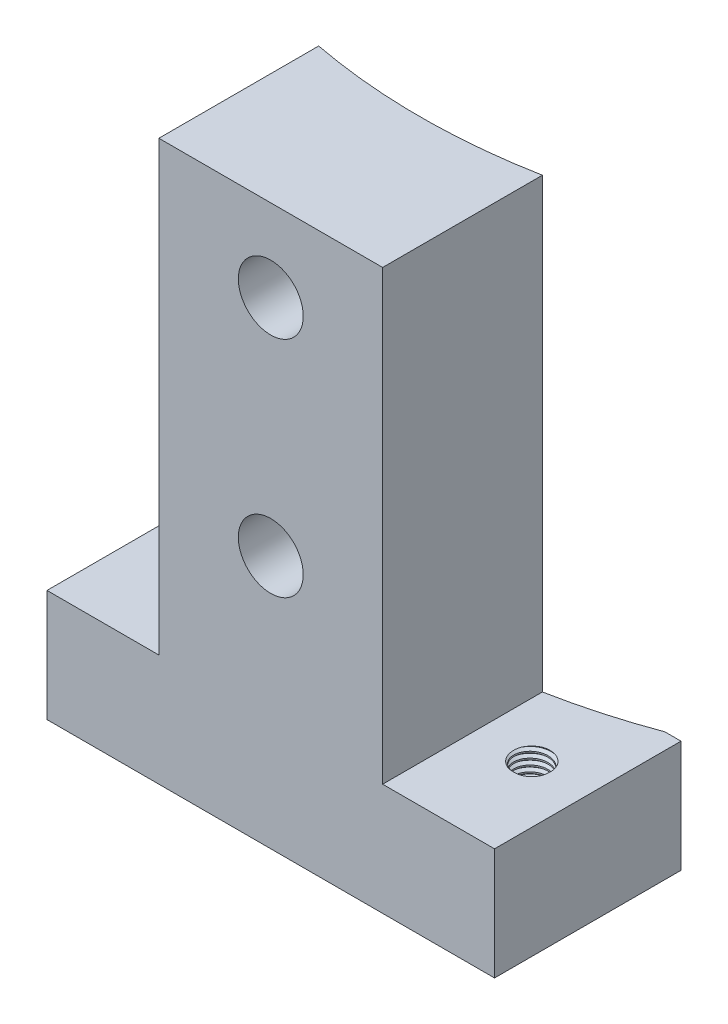
from build123d import *

# Parameters (mm, degrees)
SKIZZE1_W                       = 30
SKIZZE1_H                       = 75
AUFSATZ_LINEAR_AUSTRAGEN1_DEPTH = 25
SKIZZE2_W                       = 60
SKIZZE2_H                       = 25
AUFSATZ_LINEAR_AUSTRAGEN2_DEPTH = 15
SKIZZE3_R                       = 80
SCHNITT_LINEAR_AUSTRAGEN1_DEPTH = 80
SKIZZE4_R                       = 2.6
SCHNITT_LINEAR_AUSTRAGEN2_DEPTH = 80
SKIZZE5_R                       = 4.35
SCHNITT_LINEAR_AUSTRAGEN3_DEPTH = 13
SKIZZE6_R                       = 2.3
SCHNITT_LINEAR_AUSTRAGEN4_DEPTH = 18
GEWINDE1_PITCH                  = 0.8
GEWINDE2_PITCH                  = 0.8


with BuildPart() as part:
    # Skizze1 → Aufsatz-Linear austragen1 (new body)
    with BuildSketch(Plane.XY):
        Rectangle(SKIZZE1_W, SKIZZE1_H)
    extrude(amount=AUFSATZ_LINEAR_AUSTRAGEN1_DEPTH)

    # Skizze2 → Aufsatz-Linear austragen2 (add)
    with BuildSketch(Plane.XZ.offset(37.5)):
        with Locations((0, 12.5)):
            Rectangle(SKIZZE2_W, SKIZZE2_H)
    extrude(amount=-AUFSATZ_LINEAR_AUSTRAGEN2_DEPTH)

    # Skizze3 → Schnitt-Linear austragen1 (cut)
    with BuildSketch(Plane(origin=(0, 37.5, 0), x_dir=(1, 0, 0), z_dir=(0, 1, 0))):
        with Locations((0, 75)):
            Circle(SKIZZE3_R)
    extrude(amount=-SCHNITT_LINEAR_AUSTRAGEN1_DEPTH, mode=Mode.SUBTRACT)

    # Skizze4 → Schnitt-Linear austragen2 (cut)
    with BuildSketch(Plane.XY.offset(25)):
        with Locations((0, -3.5)):
            Circle(SKIZZE4_R)
        with Locations((0, 26.5)):
            Circle(SKIZZE4_R)
    extrude(amount=-SCHNITT_LINEAR_AUSTRAGEN2_DEPTH, mode=Mode.SUBTRACT)

    # Skizze5 → Schnitt-Linear austragen3 (cut)
    with BuildSketch(Plane.XY.offset(25)):
        with Locations((0, -3.5)):
            Circle(SKIZZE5_R)
        with Locations((0, 26.5)):
            Circle(SKIZZE5_R)
    extrude(amount=-SCHNITT_LINEAR_AUSTRAGEN3_DEPTH, mode=Mode.SUBTRACT)

    # Skizze6 → Schnitt-Linear austragen4 (cut)
    with BuildSketch(Plane(origin=(0, -22.5, 0), x_dir=(1, 0, 0), z_dir=(0, 1, 0))):
        with Locations(Location((-22.5, -12.5, 0), (0, 0, 270))):
            Circle(SKIZZE6_R)
        with Locations(Location((22.5, -12.5, 0), (0, 0, 270))):
            Circle(SKIZZE6_R)
    extrude(amount=-SCHNITT_LINEAR_AUSTRAGEN4_DEPTH, mode=Mode.SUBTRACT)

    # Gewinde1: the profile of Gewindeprofil1 profile screwed along a right-hand helix of 25 turns, 8 arcs to a turn; built about Z, then put on its axis
    gewinde1_z = Axis((0, 0, 0), (0, 0, 1))
    gewinde1_corners = [(2.2997, 0, -0.000173205), (2.7330127, 0, 0.249999999), (2.7330127, 0, 0.349999999), (2.2997, 0, 0.600173203)]
    with BuildLine(mode=Mode.PRIVATE) as gewinde1_profile:
        Line(gewinde1_corners[0], gewinde1_corners[1])
        Line(gewinde1_corners[1], gewinde1_corners[2])
        Line(gewinde1_corners[2], gewinde1_corners[3])
        Line(gewinde1_corners[3], gewinde1_corners[0])
    gewinde1_cap = Face(gewinde1_profile.wire())
    gewinde1_turn_angles = [0, 22.5, 45, 67.5, 90, 112.5, 135, 157.5, 180, 202.5, 225, 247.5, 270, 292.5, 315, 337.5, 360]
    gewinde1_turn_weights = [1, 0.9238795325112867, 1, 0.9238795325112867, 1, 0.9238795325112867, 1, 0.9238795325112867, 1, 0.9238795325112867, 1, 0.9238795325112867, 1, 0.9238795325112867, 1, 0.9238795325112867, 1]
    gewinde1_turn_rails = [Edge.make_bspline([Vector(p[0], p[1], 0).rotate(gewinde1_z, gewinde1_turn_angles[k]) / gewinde1_turn_weights[k] + Vector(0, 0, p[2] + GEWINDE1_PITCH * gewinde1_turn_angles[k] / 360) for k in range(17)], [0, 0, 0, 1, 1, 2, 2, 3, 3, 4, 4, 5, 5, 6, 6, 7, 7, 8, 8, 8], 2, gewinde1_turn_weights) for p in gewinde1_corners]
    gewinde1_turn_sides = [Face.make_surface_from_curves(gewinde1_turn_rails[p[0]], gewinde1_turn_rails[p[1]]) for p in [(0, 1), (1, 2), (2, 3), (3, 0)]]
    gewinde1 = Plane(origin=(22.5, -37.5, 12.5), x_dir=(1, 0, 0), z_dir=(0, 1, 0)) * Solid(Shell([*[p.moved(Location((0, 0, GEWINDE1_PITCH * i))) for i in range(25) for p in gewinde1_turn_sides], gewinde1_cap, gewinde1_cap.rotate(gewinde1_z, 9000).moved(Location((0, 0, GEWINDE1_PITCH * 9000 / 360)))]))
    add(gewinde1, mode=Mode.SUBTRACT)

    # Gewinde2: the profile of Gewindeprofil2 profile screwed along a right-hand helix of 25 turns, 8 arcs to a turn; built about Z, then put on its axis
    gewinde2_z = Axis((0, 0, 0), (0, 0, 1))
    gewinde2_corners = [(2.2997, 0, -0.000173205), (2.7330127, 0, 0.249999999), (2.7330127, 0, 0.349999999), (2.2997, 0, 0.600173203)]
    with BuildLine(mode=Mode.PRIVATE) as gewinde2_profile:
        Line(gewinde2_corners[0], gewinde2_corners[1])
        Line(gewinde2_corners[1], gewinde2_corners[2])
        Line(gewinde2_corners[2], gewinde2_corners[3])
        Line(gewinde2_corners[3], gewinde2_corners[0])
    gewinde2_cap = Face(gewinde2_profile.wire())
    gewinde2_turn_angles = [0, 22.5, 45, 67.5, 90, 112.5, 135, 157.5, 180, 202.5, 225, 247.5, 270, 292.5, 315, 337.5, 360]
    gewinde2_turn_weights = [1, 0.9238795325112867, 1, 0.9238795325112867, 1, 0.9238795325112867, 1, 0.9238795325112867, 1, 0.9238795325112867, 1, 0.9238795325112867, 1, 0.9238795325112867, 1, 0.9238795325112867, 1]
    gewinde2_turn_rails = [Edge.make_bspline([Vector(p[0], p[1], 0).rotate(gewinde2_z, gewinde2_turn_angles[k]) / gewinde2_turn_weights[k] + Vector(0, 0, p[2] + GEWINDE2_PITCH * gewinde2_turn_angles[k] / 360) for k in range(17)], [0, 0, 0, 1, 1, 2, 2, 3, 3, 4, 4, 5, 5, 6, 6, 7, 7, 8, 8, 8], 2, gewinde2_turn_weights) for p in gewinde2_corners]
    gewinde2_turn_sides = [Face.make_surface_from_curves(gewinde2_turn_rails[p[0]], gewinde2_turn_rails[p[1]]) for p in [(0, 1), (1, 2), (2, 3), (3, 0)]]
    gewinde2 = Plane(origin=(-22.5, -37.5, 12.5), x_dir=(1, 0, 0), z_dir=(0, 1, 0)) * Solid(Shell([*[p.moved(Location((0, 0, GEWINDE2_PITCH * i))) for i in range(25) for p in gewinde2_turn_sides], gewinde2_cap, gewinde2_cap.rotate(gewinde2_z, 9000).moved(Location((0, 0, GEWINDE2_PITCH * 9000 / 360)))]))
    add(gewinde2, mode=Mode.SUBTRACT)


solid = part.part
